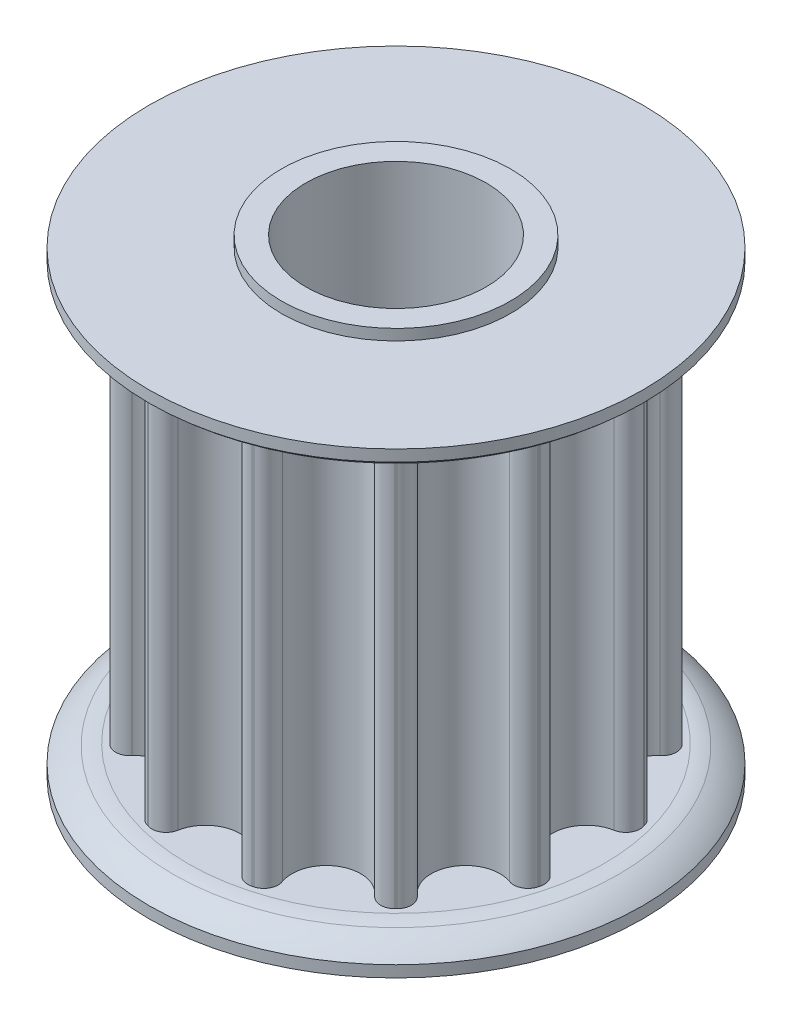
from build123d import *

# Parameters (mm, degrees)
SKETCH1_R          = 8.977796406
TOOTHOD_DEPTH      = 8.89
TOOTHPROFILE_DEPTH = 22.847884488
TOOTHPATTERN_COUNT = 12
SKETCH6_W          = 5.08
SKETCH6_H          = 0.4826
BORE_DEPTH         = 19.785838943
BORE_DEPTH_BACK    = 19.785838943
SKETCH7_R          = 4


with BuildPart() as part:
    # Sketch1 → ToothOD (new, symmetric)
    with BuildSketch(Plane(origin=(0, 0, 0), x_dir=(1, 0, 0), z_dir=(0, 1, 0))):
        Circle(SKETCH1_R)
    extrude(amount=TOOTHOD_DEPTH, both=True)

    # Sketch2 → ToothProfile (cut, through all)
    with BuildSketch(Plane(origin=(0, 8.89, 0), x_dir=(1, 0, 0), z_dir=(0, 1, 0))):
        with BuildLine():
            ThreePointArc((-1.501752794, 8.177535128), (0, 6.917796406), (1.501752794, 8.177535128))
            ThreePointArc((1.501752794, 8.177535128), (1.784898523, 8.602004268), (2.28897191, 8.681096469))
            ThreePointArc((2.28897191, 8.681096469), (0, 8.977796406), (-2.28897191, 8.681096469))
            ThreePointArc((-2.28897191, 8.681096469), (-1.784898523, 8.602004268), (-1.501752794, 8.177535128))
        make_face()
    toothprofile = extrude(amount=-TOOTHPROFILE_DEPTH, mode=Mode.SUBTRACT)

    # ToothPattern: ToothProfile ×12 about axis
    toothpattern_axis = Axis((0, 8.89, 0), (0, -1, 0))
    for i in range(1, TOOTHPATTERN_COUNT):
        add(toothprofile.rotate(toothpattern_axis, i * 360 / TOOTHPATTERN_COUNT), mode=Mode.SUBTRACT)

    # Sketch4 → Flange (revolve)
    with BuildSketch(Plane.XY):
        with BuildLine():
            Line((0, -8.89), (9.231796406, -8.89))
            ThreePointArc((9.231796406, -8.89), (9.557552396, -8.915622571), (9.877368734, -8.982637424))
            ThreePointArc((9.877368734, -8.982637424), (10.445097311, -9.264197125), (10.946296406, -9.652))
            Line((10.946296406, -9.652), (10.946296406, -10.16))
            Line((10.946296406, -10.16), (0, -10.16))
            Line((0, -10.16), (0, -8.89))
        make_face()
        with BuildLine():
            Line((10.946296406, 10.16), (10.946296406, 9.652))
            ThreePointArc((10.946296406, 9.652), (10.445097311, 9.264197125), (9.877368734, 8.982637424))
            ThreePointArc((9.877368734, 8.982637424), (9.557552396, 8.915622571), (9.231796406, 8.89))
            Line((9.231796406, 8.89), (0, 8.89))
            Line((0, 8.89), (0, 10.16))
            Line((0, 10.16), (10.946296406, 10.16))
        make_face()
    revolve(axis=Axis((0, 12.09802, 0), (0, -1, 0)))

    # Sketch6 → TopBearingBoss (revolve)
    with BuildSketch(Plane.XY):
        with Locations((2.54, 10.4013)):
            Rectangle(SKETCH6_W, SKETCH6_H)
    topbearingboss = revolve(axis=Axis((0, 12.09802, 0), (0, -1, 0)))

    # BottomBearingBoss: TopBearingBoss across plane
    add(topbearingboss.mirror(Plane.ZX))

    # Sketch7 → Bore (cut, two sides: drawn at the far end of the back side and taken through both)
    with BuildSketch(Plane.XZ.offset(-BORE_DEPTH_BACK)):
        Circle(SKETCH7_R)
    extrude(amount=BORE_DEPTH + BORE_DEPTH_BACK, mode=Mode.SUBTRACT)


solid = part.part
